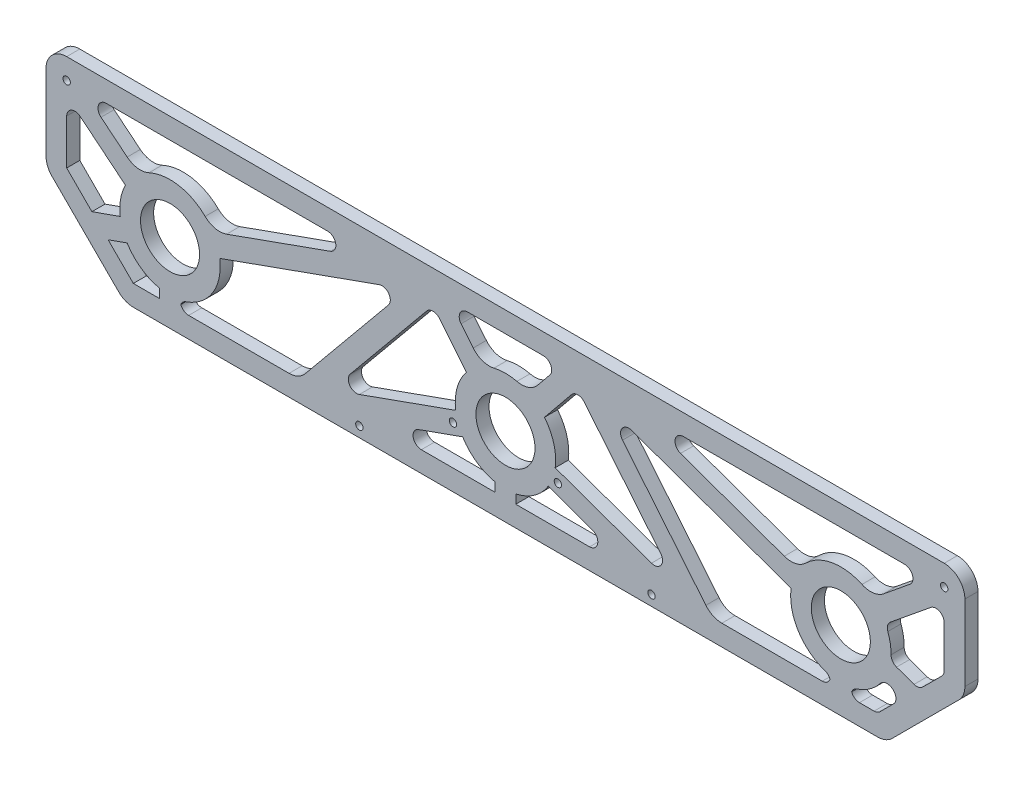
from build123d import *

# Parameters (mm, degrees)
SKETCH1_R           = 14.2875
BOSS_EXTRUDE1_DEPTH = 6.35
BOSS_EXTRUDE2_DEPTH = 6.35
FILLET1_R           = 10
FILLET2_R           = 4
FILLET3_R           = 4
SKETCH3_R           = 1.778
CUT_EXTRUDE1_DEPTH  = 10
SKETCH4_R           = 1.778
CUT_EXTRUDE2_DEPTH  = 10


with BuildPart() as part:
    # Sketch1 → Boss-Extrude1 (new body)
    with BuildSketch(Plane.XY):
        with BuildLine():
            Line((2.928932188, 35.171067812), (35.171067812, 2.928932188))
            ThreePointArc((35.171067812, 2.928932188), (38.4153013, 0.761204675), (42.242135624, 0))
            Line((42.242135624, 0), (402.257864376, 0))
            ThreePointArc((402.257864376, 0), (406.0846987, 0.761204675), (409.328932188, 2.928932188))
            Line((409.328932188, 2.928932188), (441.571067812, 35.171067812))
            ThreePointArc((441.571067812, 35.171067812), (443.738795325, 38.4153013), (444.5, 42.242135624))
            Line((444.5, 42.242135624), (444.5, 78.9))
            ThreePointArc((444.5, 78.9), (441.571067812, 85.971067812), (434.5, 88.9))
            Line((434.5, 88.9), (10, 88.9))
            ThreePointArc((10, 88.9), (2.928932188, 85.971067812), (0, 78.9))
            Line((0, 78.9), (0, 42.242135624))
            ThreePointArc((0, 42.242135624), (0.761204675, 38.4153013), (2.928932188, 35.171067812))
        make_face()
        with Locations((60, 38.1)):
            Circle(SKETCH1_R, mode=Mode.SUBTRACT)
        with Locations((384.5, 38.1)):
            Circle(SKETCH1_R, mode=Mode.SUBTRACT)
        with Locations((222.25, 38.1)):
            Circle(SKETCH1_R, mode=Mode.SUBTRACT)
        with BuildLine():
            Line((42.242135624, 10), (55, 10))
            Line((55, 10), (55, 14.332739824))
            ThreePointArc((55, 14.332739824), (45.977844894, 18.269169901), (39.258984185, 25.463033624))
            Line((39.258984185, 25.463033624), (30.039080729, 22.203054895))
            Line((30.039080729, 22.203054895), (42.242135624, 10))
        make_face(mode=Mode.SUBTRACT)
        with BuildLine():
            Line((402.257864376, 10), (414.460919271, 22.203054895))
            Line((414.460919271, 22.203054895), (405.241015815, 25.463033624))
            ThreePointArc((405.241015815, 25.463033624), (398.522155106, 18.269169901), (389.5, 14.332739824))
            Line((389.5, 14.332739824), (389.5, 10))
            Line((389.5, 10), (402.257864376, 10))
        make_face(mode=Mode.SUBTRACT)
        with BuildLine():
            Line((434.5, 42.242135624), (434.5, 72.446597797))
            Line((434.5, 72.446597797), (406.075642814, 49.252322333))
            ThreePointArc((406.075642814, 49.252322333), (408.427959025, 42.263584169), (408.574576932, 34.891043503))
            Line((408.574576932, 34.891043503), (420.045712746, 30.835072751))
            Line((420.045712746, 30.835072751), (422.296945105, 30.039080729))
            Line((422.296945105, 30.039080729), (434.5, 42.242135624))
        make_face(mode=Mode.SUBTRACT)
        with BuildLine():
            Line((17.908581132, 78.9), (159.303289572, 78.9))
            Line((159.303289572, 78.9), (80.698128287, 50.807090212))
            ThreePointArc((80.698128287, 50.807090212), (64.123087075, 62.034970424), (44.746603764, 57.000173532))
            Line((44.746603764, 57.000173532), (17.908581132, 78.9))
        make_face(mode=Mode.SUBTRACT)
        with BuildLine():
            Line((10, 42.242135624), (10, 72.446597797))
            Line((10, 72.446597797), (38.424357186, 49.252322333))
            ThreePointArc((38.424357186, 49.252322333), (36.072040975, 42.263584169), (35.925423068, 34.891043503))
            Line((35.925423068, 34.891043503), (24.454287254, 30.835072751))
            Line((24.454287254, 30.835072751), (22.203054895, 30.039080729))
            Line((22.203054895, 30.039080729), (10, 42.242135624))
        make_face(mode=Mode.SUBTRACT)
        with BuildLine():
            Line((65, 14.332739824), (65, 10))
            Line((65, 10), (128.768147223, 10))
            Line((128.768147223, 10), (141.942274838, 14.708336864))
            Line((141.942274838, 14.708336864), (198.186421388, 34.809583517))
            ThreePointArc((198.186421388, 34.809583517), (198.85545044, 44.625159549), (203.363262878, 53.370030031))
            Line((203.363262878, 53.370030031), (185.140287975, 75.742288539))
            Line((185.140287975, 75.742288539), (184.022239752, 77.114910957))
            Line((184.022239752, 77.114910957), (175.842867511, 74.191663136))
            Line((175.842867511, 74.191663136), (84.063578612, 41.390416483))
            ThreePointArc((84.063578612, 41.390416483), (79.854530137, 24.1114229), (65, 14.332739824))
        make_face(mode=Mode.SUBTRACT)
        with BuildLine():
            Line((399.753396236, 57.000173532), (426.591418868, 78.9))
            Line((426.591418868, 78.9), (285.196710428, 78.9))
            Line((285.196710428, 78.9), (363.801871713, 50.807090212))
            ThreePointArc((363.801871713, 50.807090212), (380.376912925, 62.034970424), (399.753396236, 57.000173532))
        make_face(mode=Mode.SUBTRACT)
        with BuildLine():
            Line((158.481852777, 10), (201.551871713, 25.392909788))
            ThreePointArc((201.551871713, 25.392909788), (208.2614229, 18.245469863), (217.25, 14.332739824))
            Line((217.25, 14.332739824), (217.25, 10))
            Line((217.25, 10), (158.481852777, 10))
        make_face(mode=Mode.SUBTRACT)
        with BuildLine():
            Line((195.465766991, 78.9), (211.116677179, 59.685452953))
            ThreePointArc((211.116677179, 59.685452953), (222.25, 62.3875), (233.383322821, 59.685452953))
            Line((233.383322821, 59.685452953), (249.034233009, 78.9))
            Line((249.034233009, 78.9), (195.465766991, 78.9))
        make_face(mode=Mode.SUBTRACT)
        with BuildLine():
            Line((379.5, 14.332739824), (379.5, 10))
            Line((379.5, 10), (315.731852777, 10))
            Line((315.731852777, 10), (302.557725162, 14.708336864))
            Line((302.557725162, 14.708336864), (246.313578612, 34.809583517))
            ThreePointArc((246.313578612, 34.809583517), (245.64454956, 44.625159549), (241.136737122, 53.370030031))
            Line((241.136737122, 53.370030031), (259.359712025, 75.742288539))
            Line((259.359712025, 75.742288539), (260.477760248, 77.114910957))
            Line((260.477760248, 77.114910957), (268.657132489, 74.191663136))
            Line((268.657132489, 74.191663136), (360.436421388, 41.390416483))
            ThreePointArc((360.436421388, 41.390416483), (364.645469863, 24.1114229), (379.5, 14.332739824))
        make_face(mode=Mode.SUBTRACT)
        with BuildLine():
            Line((286.018147223, 10), (227.25, 10))
            Line((227.25, 10), (227.25, 14.332739824))
            ThreePointArc((227.25, 14.332739824), (236.2385771, 18.245469863), (242.948128287, 25.392909788))
            Line((242.948128287, 25.392909788), (286.018147223, 10))
        make_face(mode=Mode.SUBTRACT)
    extrude(amount=BOSS_EXTRUDE1_DEPTH)

    # Sketch2 → Boss-Extrude2 (add)
    with BuildSketch(Plane.XY.offset(6.35)):
        Polygon((184.022239752, 77.114910957), (174.845752388, 73.835301483), (124.908015982, 13.177953241), (122.291683488, 10), (128.768147223, 10), (137.944634587, 13.279609474), (187.243188129, 73.160568149), align=None)
        Polygon((269.654247612, 73.835301483), (319.591984018, 13.177953241), (322.208316512, 10), (315.731852777, 10), (306.555365413, 13.279609474), (257.256811871, 73.160568149), (260.477760248, 77.114910957), align=None)
    extrude(amount=-BOSS_EXTRUDE2_DEPTH)

    # Fillet1
    fillet1_edges = [part.edges().sort_by_distance(p)[0] for p in [
        (211.116677179, 59.685452953, 3.175),
        (233.383322821, 59.685452953, 3.175),
        (44.746603764, 57.000173532, 3.175),
        (80.698128287, 50.807090212, 3.175),
        (399.753396236, 57.000173532, 3.175),
        (363.801871713, 50.807090212, 3.175),
        (122.291683488, 10, 3.175),
        (322.208316512, 10, 3.175),
    ]]
    fillet(fillet1_edges, radius=FILLET1_R)

    # Fillet2
    fillet2_edges = [part.edges().sort_by_distance(p)[0] for p in [
        (249.034233009, 78.9, 3.175),
        (195.465766991, 78.9, 3.175),
        (286.018147223, 10, 3.175),
        (159.303289572, 78.9, 3.175),
        (17.908581132, 78.9, 3.175),
        (158.481852777, 10, 3.175),
        (10, 72.446597797, 3.175),
        (426.591418868, 78.9, 3.175),
        (285.196710428, 78.9, 3.175),
        (434.5, 72.446597797, 3.175),
        (174.845752388, 73.835301483, 3.175),
        (187.243188129, 73.160568149, 3.175),
        (137.944634587, 13.279609474, 3.175),
        (269.654247612, 73.835301483, 3.175),
        (306.555365413, 13.279609474, 3.175),
        (257.256811871, 73.160568149, 3.175),
    ]]
    fillet(fillet2_edges, radius=FILLET2_R)

    # Fillet3
    # the kernel refuses this fillet: 4 mm, written as the material it adds along each edge
    with BuildSketch(Plane(origin=(434.5, 42.242135624, 0), x_dir=(0, 1, 0), z_dir=(0, 0, 1)), Plane(origin=(402.257864376, 10, 0), x_dir=(0.7071067811865684, 0.7071067811865266, 0), z_dir=(0, 0, 1))) as fillet3_piece_1:
        with BuildLine():
            CenterArc((FILLET3_R * 0.414213562373, FILLET3_R), FILLET3_R, 225, 45)
            Line((-FILLET3_R * 0.292893218813, FILLET3_R * 0.292893218813), (0, 0))
            Line((0, 0), (FILLET3_R * 0.414213562373, 0))
        make_face()
    extrude(amount=6.35)
    with BuildSketch(Plane(origin=(422.296945105, 30.039080729, 0), x_dir=(-0.9428009879202438, 0.33335611165330736, 0), z_dir=(0, 0, 1))) as fillet3_piece_2:
        with BuildLine():
            CenterArc((FILLET3_R * 0.630618821441, -FILLET3_R), FILLET3_R, 90, 64.47260491)
            Line((-FILLET3_R * 0.271760517527, -FILLET3_R * 0.569057395232), (0, 0))
            Line((0, 0), (FILLET3_R * 0.630618821441, 0))
        make_face()
    extrude(amount=6.35)
    with BuildSketch(Plane(origin=(408.574576932, 34.891043503, 0), x_dir=(0.07422292500138471, 0.9972416745223992, 0), z_dir=(0, 0, 1)), Plane(origin=(389.5, 14.332739824, 0), x_dir=(0.9649431016089534, 0.262459159979783, 0), z_dir=(0, 0, 1)), Plane(origin=(65, 14.332739824, 0), x_dir=(0.9649431016089596, 0.2624591599797595, 0), z_dir=(0, 0, 1))) as fillet3_piece_3:
        with BuildLine():
            CenterArc((3.059187738, -3.993222777), FILLET3_R, 93.335760439, 71.44820939)
            Line((-0.800584668, -2.943386137), (0, 0))
            ThreePointArc((0, 0), (1.413219633, -0.04115045), (2.826439265, 0))
        make_face()
    extrude(amount=6.35)
    with BuildSketch(Plane(origin=(406.075642814, 49.252322333, 0), x_dir=(0.774785119901029, 0.632224657839243, 0), z_dir=(0, 0, 1))) as fillet3_piece_4:
        with BuildLine():
            CenterArc((3.050320928, -4), FILLET3_R, 90, 71.44820939)
            ThreePointArc((-0.741824875, -2.727353071), (-0.331204595, -1.374476848), (0, 0))
            Line((0, 0), (3.050320928, 0))
        make_face()
    extrude(amount=6.35)
    with BuildSketch(Plane(origin=(414.460919271, 22.203054895, 0), x_dir=(-0.9428009879202406, 0.33335611165331624, 0), z_dir=(0, 0, 1))) as fillet3_piece_5:
        with BuildLine():
            CenterArc((FILLET3_R * 1.58574398036, FILLET3_R), FILLET3_R, 154.47260491, 115.52739509)
            Line((FILLET3_R * 0.68336464139, FILLET3_R * 1.43094260477), (0, 0))
            Line((0, 0), (FILLET3_R * 1.58574398036, 0))
        make_face()
    extrude(amount=6.35)
    with BuildSketch(Plane(origin=(405.241015815, 25.463033624, 0), x_dir=(-0.5691164356367163, -0.82225694444508, 0), z_dir=(0, 0, 1)), Plane(origin=(379.5, 14.332739824, 0), x_dir=(-0.9649431016089597, 0.2624591599797589, 0), z_dir=(0, 0, 1))) as fillet3_piece_6:
        with BuildLine():
            CenterArc((3.059187738, 3.993222777), FILLET3_R, 195.216030171, 71.44820939)
            Line((-0.800584668, 2.943386137), (0, 0))
            ThreePointArc((0, 0), (1.413219633, 0.04115045), (2.826439265, 0))
        make_face()
    extrude(amount=6.35)
    with BuildSketch(Plane(origin=(389.5, 10, 0), x_dir=(1, 0, 0), z_dir=(0, 0, 1)), Plane(origin=(65, 10, 0), x_dir=(1, 0, 0), z_dir=(0, 0, 1))) as fillet3_piece_7:
        with BuildLine():
            CenterArc((FILLET3_R, FILLET3_R), FILLET3_R, 180, 90)
            Line((0, FILLET3_R), (0, 0))
            Line((0, 0), (FILLET3_R, 0))
        make_face()
    extrude(amount=6.35)
    with BuildSketch(Plane(origin=(379.5, 10, 0), x_dir=(-1, 0, 0), z_dir=(0, 0, 1))) as fillet3_piece_8:
        with BuildLine():
            CenterArc((FILLET3_R, -FILLET3_R), FILLET3_R, 90, 90)
            Line((0, -FILLET3_R), (0, 0))
            Line((0, 0), (FILLET3_R, 0))
        make_face()
    extrude(amount=6.35)

    # Sketch3 → Cut-Extrude1 (cut)
    with BuildSketch(Plane(origin=(0, 0, 0), x_dir=(-1, 0, 0), z_dir=(0, 0, -1))):
        with Locations((-434.5, 78.9)):
            Circle(SKETCH3_R)
        with Locations((-247.620647359, 29.032716175)):
            Circle(SKETCH3_R)
        with Locations((-196.879352641, 29.032716175)):
            Circle(SKETCH3_R)
        with Locations(Location((-10, 78.9, 0), (0, 0, 180))):
            Circle(SKETCH3_R)
    extrude(amount=-CUT_EXTRUDE1_DEPTH, mode=Mode.SUBTRACT)

    # Sketch4 → Cut-Extrude2 (cut)
    with BuildSketch(Plane(origin=(0, 0, 0), x_dir=(-1, 0, 0), z_dir=(0, 0, -1))):
        with Locations((-292.912963738, 5)):
            Circle(SKETCH4_R)
        with Locations((-151.587036262, 5)):
            Circle(SKETCH4_R)
    extrude(amount=-CUT_EXTRUDE2_DEPTH, mode=Mode.SUBTRACT)


solid = part.part
